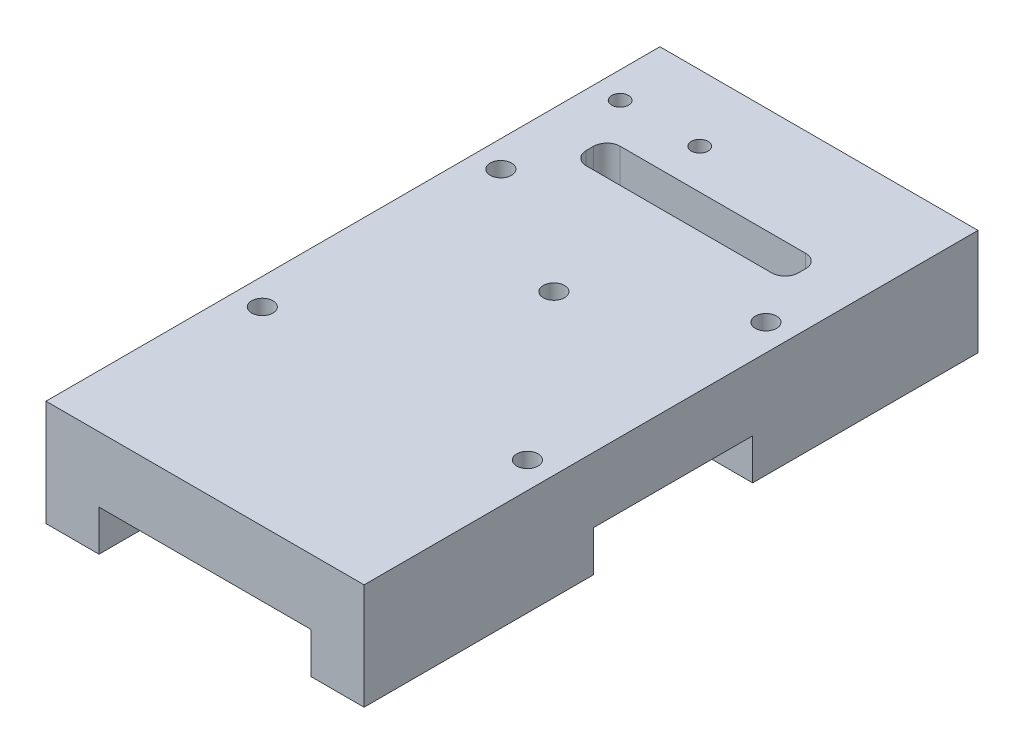
from build123d import *

# Parameters (mm, degrees)
BOSS_EXTRUDE1_DEPTH         = 12.7
BOSS_EXTRUDE1_DEPTH_BACK    = 12.7
SKETCH1_W                   = 76.2
SKETCH1_H                   = 147.066
SKETCH2_R                   = 4.7625
CUT_EXTRUDE1_DEPTH          = 25.4
CUT_EXTRUDE2_DEPTH          = 9.779
CUT_EXTRUDE4_DEPTH          = 84.785452729
CUT_EXTRUDE4_DEPTH_BACK     = 84.785452729
F_1_4_20_TAPPED_HOLE1_D     = 5.1054
F_1_4_20_TAPPED_HOLE1_DEPTH = 19.05
F_1_4_20_TAPPED_HOLE1_TIP   = 1.533816902
SKETCH9_R                   = 2.5527
SKETCH9_R_2                 = 2.0193
CUT_EXTRUDE5_DEPTH          = 87.62489301
CUT_EXTRUDE6_REACH          = 103.385


with BuildPart() as part:
    # Sketch1 → Boss-Extrude1 (new, two sides: drawn at the far end of the back side and taken through both)
    with BuildSketch(Plane(origin=(0, 0, 0), x_dir=(1, 0, 0), z_dir=(0, 1, 0)).offset(-BOSS_EXTRUDE1_DEPTH_BACK)):
        Rectangle(SKETCH1_W, SKETCH1_H)
    extrude(amount=BOSS_EXTRUDE1_DEPTH + BOSS_EXTRUDE1_DEPTH_BACK)

    # Sketch2 → Cut-Extrude1 (cut)
    with BuildSketch(Plane(origin=(0, 0, -73.533), x_dir=(-1, 0, 0), z_dir=(0, 0, -1))):
        with Locations((0, -12.7)):
            Circle(SKETCH2_R)
    extrude(amount=-CUT_EXTRUDE1_DEPTH, mode=Mode.SUBTRACT)

    # Sketch3 → Cut-Extrude2 (cut)
    with BuildSketch(Plane(origin=(0, -12.7, 0), x_dir=(-1, 0, 0), z_dir=(0, -1, 0))):
        with BuildLine():
            Line((-19.05, -83.058), (19.05, -83.058))
            ThreePointArc((19.05, -83.058), (23.540128061, -81.198128061), (25.4, -76.708))
            Line((25.4, -76.708), (25.4, -18.542))
            Line((25.4, -18.542), (44.45, -18.542))
            Line((44.45, -18.542), (44.45, 19.558))
            Line((44.45, 19.558), (-44.45, 19.558))
            Line((-44.45, 19.558), (-44.45, -18.542))
            Line((-44.45, -18.542), (-25.4, -18.542))
            Line((-25.4, -18.542), (-25.4, -76.708))
            ThreePointArc((-25.4, -76.708), (-23.540128061, -81.198128061), (-19.05, -83.058))
        make_face()
    extrude(amount=-CUT_EXTRUDE2_DEPTH, mode=Mode.SUBTRACT)

    # Sketch5 → Cut-Extrude4 (cut, two sides: drawn at the far end of the back side and taken through both)
    with BuildSketch(Plane(origin=(0, 0, 0), x_dir=(1, 0, 0), z_dir=(0, 1, 0)).offset(-CUT_EXTRUDE4_DEPTH_BACK)):
        with BuildLine():
            Line((22.225, 48.133), (-22.225, 48.133))
            ThreePointArc((-22.225, 48.133), (-24.47006403, 47.20306403), (-25.4, 44.958))
            Line((-25.4, 44.958), (-25.4, 43.18))
            ThreePointArc((-25.4, 43.18), (-24.47006403, 40.93493597), (-22.225, 40.005))
            Line((-22.225, 40.005), (22.225, 40.005))
            ThreePointArc((22.225, 40.005), (24.47006403, 40.93493597), (25.4, 43.18))
            Line((25.4, 43.18), (25.4, 44.958))
            ThreePointArc((25.4, 44.958), (24.47006403, 47.20306403), (22.225, 48.133))
        make_face()
    extrude(amount=CUT_EXTRUDE4_DEPTH + CUT_EXTRUDE4_DEPTH_BACK, mode=Mode.SUBTRACT)

    # 1/4-20 Tapped Hole1
    with Locations(Plane(origin=(-11.034450397, 12.7, 14.547513529), x_dir=(-1, 0, 0), z_dir=(0, 1, 0))):
        with Locations((-11.034450397, -24.580513529)):
            Hole(F_1_4_20_TAPPED_HOLE1_D / 2, depth=F_1_4_20_TAPPED_HOLE1_DEPTH)
            with Locations((0, 0, -(F_1_4_20_TAPPED_HOLE1_DEPTH + F_1_4_20_TAPPED_HOLE1_TIP / 2))):  # 118° drill point
                Cone(0, F_1_4_20_TAPPED_HOLE1_D / 2, F_1_4_20_TAPPED_HOLE1_TIP, mode=Mode.SUBTRACT)

    # Sketch9 → Cut-Extrude5 (cut, through all)
    with BuildSketch(Plane(origin=(0, -12.7, 0), x_dir=(-1, 0, 0), z_dir=(0, -1, 0))):
        with Locations((31.75, 29.083)):
            Circle(SKETCH9_R)
        with Locations((31.75, -28.067)):
            Circle(SKETCH9_R)
        with Locations((-31.75, -28.067)):
            Circle(SKETCH9_R)
        with Locations((-31.75, 29.083)):
            Circle(SKETCH9_R)
        with Locations((31.75, 57.658)):
            Circle(SKETCH9_R_2)
        with Locations((12.7, 57.658)):
            Circle(SKETCH9_R_2)
    extrude(amount=-CUT_EXTRUDE5_DEPTH, mode=Mode.SUBTRACT)

    # Sketch10 → Cut-Extrude6 (cut, up to next)
    with BuildSketch(Plane.XY.offset(-19.558), mode=Mode.PRIVATE) as cut_extrude6_sk1:
        with BuildLine():
            Line((-10.939706577, -10.414), (-12.209706577, -10.414))
            Line((-12.209706577, -10.414), (-12.209706577, -14.986))
            Line((-12.209706577, -14.986), (-10.939706577, -14.986))
            ThreePointArc((-10.939706577, -14.986), (0, -23.876), (10.939706577, -14.986))
            Line((10.939706577, -14.986), (12.209706577, -14.986))
            Line((12.209706577, -14.986), (12.209706577, -10.414))
            Line((12.209706577, -10.414), (10.939706577, -10.414))
            ThreePointArc((10.939706577, -10.414), (0, -1.524), (-10.939706577, -10.414))
        make_face()
    cut_extrude6_tool1 = extrude(cut_extrude6_sk1.sketch, amount=-CUT_EXTRUDE6_REACH, mode=Mode.PRIVATE) & part.part
    add(cut_extrude6_tool1.solids().sort_by_distance((0, -12.7, -19.558))[0], mode=Mode.SUBTRACT)


solid = part.part
